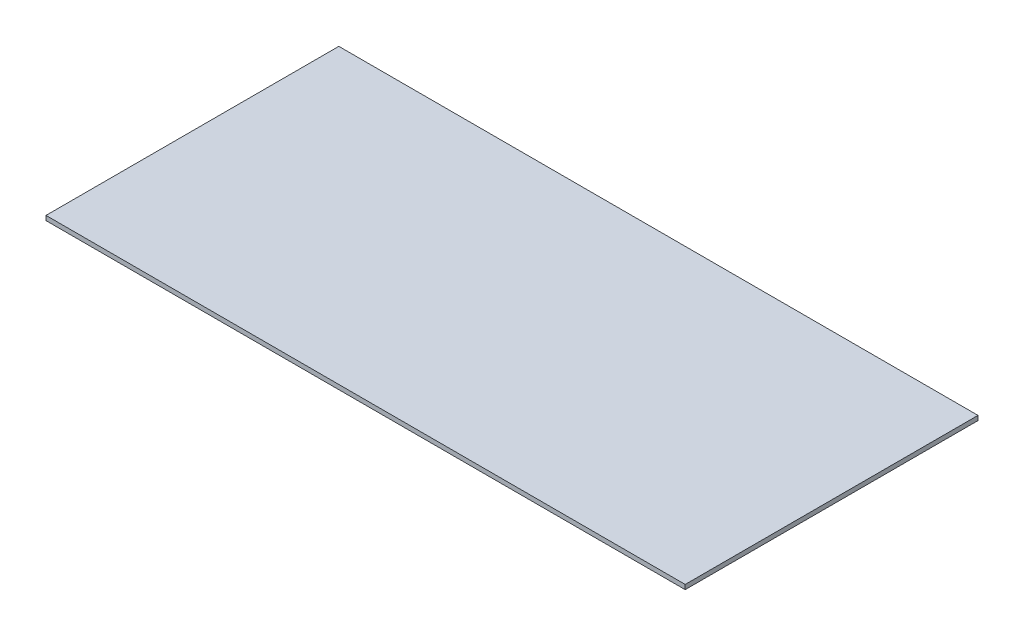
from build123d import *

# Parameters (mm, degrees)
SKETCH1_W           = 1790
SKETCH1_H           = 820
BOSS_EXTRUDE1_DEPTH = 12.7


with BuildPart() as part:
    # Sketch1 → Boss-Extrude1 (new body)
    with BuildSketch(Plane(origin=(0, 0, 0), x_dir=(1, 0, 0), z_dir=(0, 1, 0))):
        Rectangle(SKETCH1_W, SKETCH1_H)
    extrude(amount=BOSS_EXTRUDE1_DEPTH)


solid = part.part
